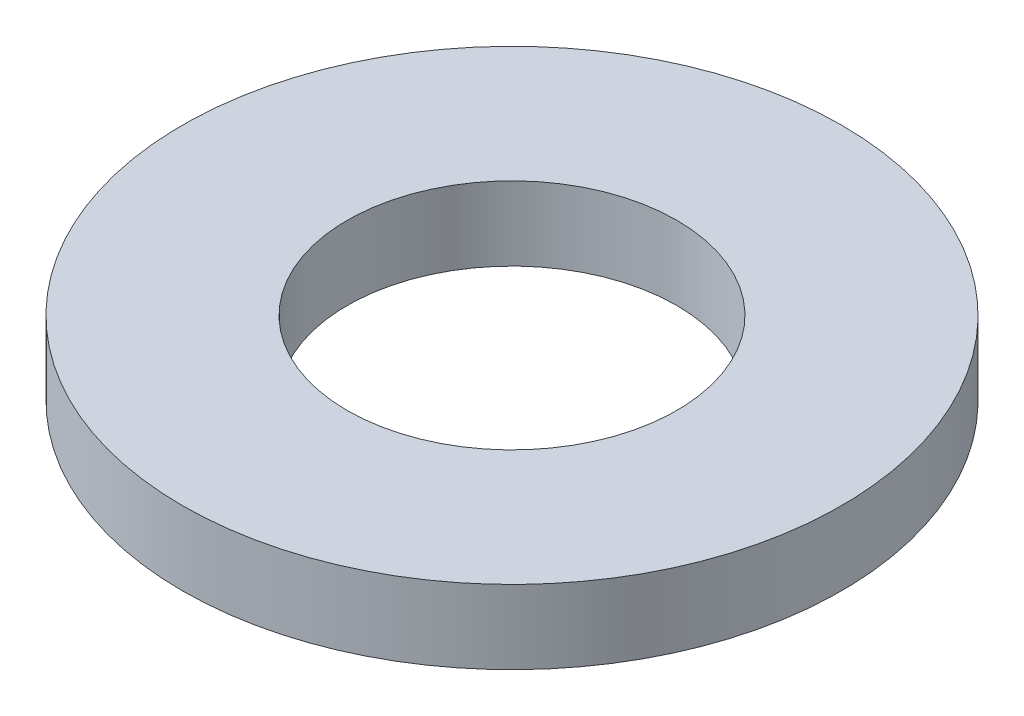
from build123d import *

# Parameters (mm, degrees)
SKETCH1_R           = 3.175
BOSS_EXTRUDE1_DEPTH = 0.7112
SKETCH5_R           = 1.5875
CUT_EXTRUDE1_DEPTH  = 5.546103325


with BuildPart() as part:
    # Sketch1 → Boss-Extrude1 (new body)
    with BuildSketch(Plane(origin=(0, 0, 0), x_dir=(1, 0, 0), z_dir=(0, 1, 0))):
        Circle(SKETCH1_R)
    extrude(amount=BOSS_EXTRUDE1_DEPTH)

    # Sketch5 → Cut-Extrude1 (cut, through all)
    with BuildSketch(Plane(origin=(0, 0.7112, 0), x_dir=(-1, 0, 0), z_dir=(0, 1, 0))):
        Circle(SKETCH5_R)
    extrude(amount=-CUT_EXTRUDE1_DEPTH, mode=Mode.SUBTRACT)


solid = part.part
